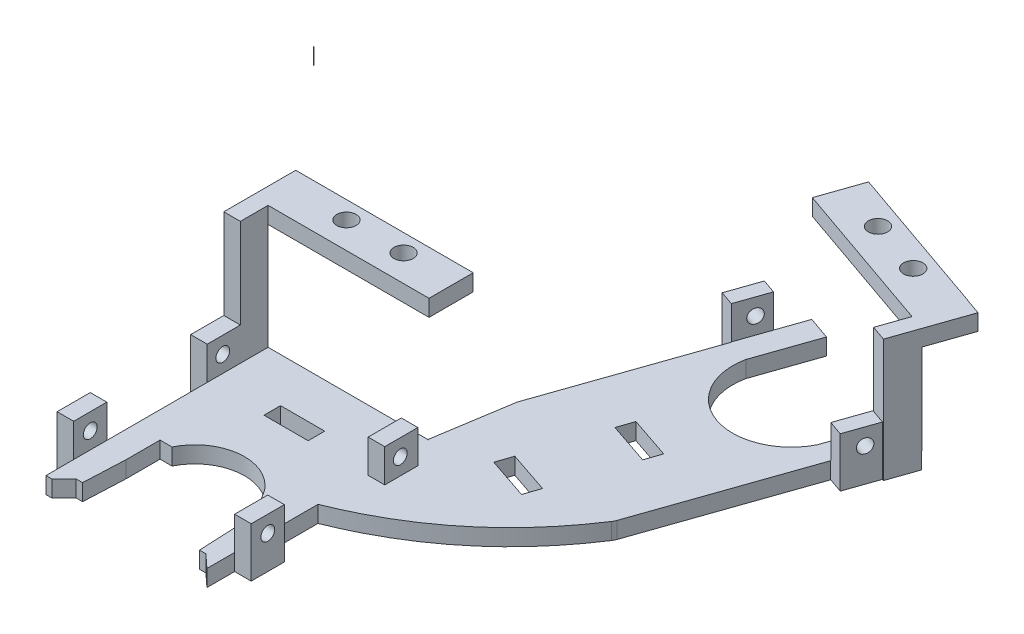
from build123d import *

# Parameters (mm, degrees)
SKETCH1_W                 = 29.13
SKETCH1_H                 = 40.2
BOSS_EXTRUDE1_DEPTH       = 3
SKETCH3_W                 = 6
SKETCH3_H                 = 3
BOSS_EXTRUDE2_DEPTH       = 3
SKETCH4_W                 = 3
SKETCH4_H                 = 6
BOSS_EXTRUDE3_DEPTH       = 6
SKETCH6_W                 = 6
SKETCH6_H                 = 3
BOSS_EXTRUDE4_DEPTH       = 2
SKETCH7_W                 = 3.000000005
SKETCH7_H                 = 6
BOSS_EXTRUDE6_DEPTH       = 6
SKETCH9_R                 = 1.25
CUT_EXTRUDE1_DEPTH        = 3
SKETCH8_R                 = 1.250000001
CUT_EXTRUDE2_DEPTH        = 3
SKETCH11_W                = 6
SKETCH11_H                = 3
BOSS_EXTRUDE7_DEPTH       = 3
SKETCH19_W                = 3
SKETCH19_H                = 6
BOSS_EXTRUDE11_DEPTH      = 6
SKETCH21_W                = 6
SKETCH21_H                = 3
BOSS_EXTRUDE12_DEPTH      = 3
SKETCH22_W                = 3
SKETCH22_H                = 6
BOSS_EXTRUDE13_DEPTH      = 6
SKETCH24_R                = 1.25
CUT_EXTRUDE5_DEPTH        = 4
SKETCH23_R                = 1.25
CUT_EXTRUDE6_DEPTH        = 4
CUT_EXTRUDE8_DEPTH        = 4
CUT_EXTRUDE11_DEPTH       = 4
SKETCH30_W                = 25.92
SKETCH30_H                = 3
CUT_EXTRUDE12_DEPTH       = 15
SKETCH33_W                = 29.17650364
SKETCH33_H                = 3
BOSS_EXTRUDE14_DEPTH      = 40.3
SKETCH34_W                = 21.00258235
SKETCH34_H                = 3
CUT_EXTRUDE15_DEPTH       = 25
CUT_EXTRUDE16_DEPTH       = 5
SKETCH37_W                = 4.5
SKETCH37_H                = 3
SKETCH37_W_2              = 1.5
BOSS_EXTRUDE15_DEPTH      = 3
BOSS_EXTRUDE16_DEPTH      = 6
SKETCH41_W                = 6
SKETCH41_H                = 3
BOSS_EXTRUDE17_DEPTH      = 2.8
BOSS_EXTRUDE18_DEPTH      = 6
SKETCH44_R                = 1.25
CUT_EXTRUDE19_DEPTH       = 7
SKETCH45_R                = 1.249999996
CUT_EXTRUDE20_DEPTH       = 5
SKETCH46_W                = 5.02
SKETCH46_H                = 3
BOSS_EXTRUDE19_DEPTH      = 3
SKETCH48_W                = 3
SKETCH48_H                = 5.02
BOSS_EXTRUDE20_DEPTH      = 22.25
BOSS_EXTRUDE22_DEPTH      = 29.13
BOSS_EXTRUDE22_DEPTH_BACK = 3
SKETCH50_W                = 8
SKETCH50_H                = 3
SKETCH51_R                = 1.75
CUT_EXTRUDE21_DEPTH       = 5
SKETCH56_W                = 3.994197227
SKETCH56_H                = 3.994197227
CUT_EXTRUDE26_DEPTH       = 0.1
FILLET4_START             = -19
FILLET4_DEPTH             = 5
BOSS_EXTRUDE28_DEPTH      = 0.21
BOSS_EXTRUDE29_DEPTH      = 3
BOSS_EXTRUDE30_DEPTH      = 1.95
BOSS_EXTRUDE30_DEPTH_BACK = 4
SKETCH68_W                = 4.32399603
SKETCH68_H                = 3
SKETCH69_W                = 3.919724064
SKETCH69_H                = 3
BOSS_EXTRUDE31_DEPTH      = 1.83
SKETCH70_W                = 5.44243662
SKETCH70_H                = 3
BOSS_EXTRUDE32_DEPTH      = 3.1
BOSS_EXTRUDE33_DEPTH      = 19.18
SKETCH72_W                = 3.07
SKETCH72_H                = 2.93342148
BOSS_EXTRUDE34_DEPTH      = 8
SKETCH73_W                = 8
SKETCH73_H                = 2.93342148
BOSS_EXTRUDE35_DEPTH      = 29.13
SKETCH74_R                = 1.75
CUT_EXTRUDE27_DEPTH       = 5
BOSS_EXTRUDE36_DEPTH      = 3
BOSS_EXTRUDE37_DEPTH      = 3
SKETCH77_W                = 8
SKETCH77_H                = 3
CUT_EXTRUDE28_DEPTH       = 10
CUT_EXTRUDE29_DEPTH       = 10


with BuildPart() as part:
    # Sketch1 → Boss-Extrude1 (new body)
    with BuildSketch(Plane(origin=(0, 0, 0), x_dir=(1, 0, 0), z_dir=(0, 1, 0))):
        with Locations((-32.231128585, -983.966354464)):
            Rectangle(SKETCH1_W, SKETCH1_H)
        with BuildLine():
            Line((-15.507778999, -950.239071497), (-17.666128585, -963.866354464))
            Line((-17.666128585, -963.866354464), (-17.666128585, -983.966354464))
            add(Edge.make_bspline(
                [(11.825950039, -959.709415703), (1.028086592, -976.494542347), (-17.666128585, -983.966354464)],
                knots=[0, 0, 0, 1, 1, 1], degree=2))
            Line((11.825950039, -959.709415703), (-15.497121464, -950.208422428))
            Line((-15.497121464, -950.208422428), (-15.507778999, -950.239071497))
        make_face()
    extrude(amount=-BOSS_EXTRUDE1_DEPTH)

    # Sketch3 → Boss-Extrude2 (add)
    with BuildSketch(Plane.ZY.offset(46.796128585)):
        with Locations((971.886354464, -1.5)):
            Rectangle(SKETCH3_W, SKETCH3_H)
    extrude(amount=BOSS_EXTRUDE2_DEPTH)

    # Sketch4 → Boss-Extrude3 (add)
    with BuildSketch(Plane.XZ.offset(3)):
        with Locations((-48.296128585, 971.886354464)):
            Rectangle(SKETCH4_W, SKETCH4_H)
    extrude(amount=BOSS_EXTRUDE3_DEPTH)

    # Sketch6 → Boss-Extrude4 (add)
    with BuildSketch(Plane(origin=(-17.666128585, 0, 0), x_dir=(0, 0, -1), z_dir=(1, 0, 0))):
        with Locations((-971.886354464, -1.5)):
            Rectangle(SKETCH6_W, SKETCH6_H)
    extrude(amount=BOSS_EXTRUDE4_DEPTH)

    # Sketch7 → Boss-Extrude6 (add)
    with BuildSketch(Plane.XZ.offset(3)):
        with Locations((-16.166128583, 971.886354464)):
            Rectangle(SKETCH7_W, SKETCH7_H)
    extrude(amount=BOSS_EXTRUDE6_DEPTH)

    # Sketch9 → Cut-Extrude1 (cut)
    with BuildSketch(Plane.ZY.offset(17.666128585)):
        with Locations((972.066354464, -6)):
            Circle(SKETCH9_R)
    extrude(amount=-CUT_EXTRUDE1_DEPTH, mode=Mode.SUBTRACT)

    # Sketch8 → Cut-Extrude2 (cut)
    with BuildSketch(Plane(origin=(-49.796128585, 0, 0), x_dir=(0, 0, -1), z_dir=(1, 0, 0))):
        with Locations(Location((-972.066168305, -5.999675203, 0), (0, 0, 180))):
            Circle(SKETCH8_R)
    extrude(amount=CUT_EXTRUDE2_DEPTH, mode=Mode.SUBTRACT)

    # Sketch11 → Boss-Extrude7 (add)
    with BuildSketch(Plane.ZY.offset(46.796128585)):
        with Locations((996.056354464, -1.5)):
            Rectangle(SKETCH11_W, SKETCH11_H)
    extrude(amount=BOSS_EXTRUDE7_DEPTH)

    # Sketch19 → Boss-Extrude11 (add)
    with BuildSketch(Plane.XZ.offset(3)):
        with Locations((-48.296128585, 996.056354464)):
            Rectangle(SKETCH19_W, SKETCH19_H)
    extrude(amount=BOSS_EXTRUDE11_DEPTH)

    # Sketch21 → Boss-Extrude12 (add)
    with BuildSketch(Plane(origin=(-17.666128585, 0, 0), x_dir=(0, 0, -1), z_dir=(1, 0, 0))):
        with Locations((-996.056354464, -1.5)):
            Rectangle(SKETCH21_W, SKETCH21_H)
    extrude(amount=BOSS_EXTRUDE12_DEPTH)

    # Sketch22 → Boss-Extrude13 (add)
    with BuildSketch(Plane.XZ.offset(3)):
        with Locations((-16.166128585, 996.056354464)):
            Rectangle(SKETCH22_W, SKETCH22_H)
    extrude(amount=BOSS_EXTRUDE13_DEPTH)

    # Sketch24 → Cut-Extrude5 (cut)
    with BuildSketch(Plane(origin=(-46.796128585, 0, 0), x_dir=(0, 0, -1), z_dir=(1, 0, 0))):
        with Locations((-996.058375158, -6)):
            Circle(SKETCH24_R)
    extrude(amount=-CUT_EXTRUDE5_DEPTH, mode=Mode.SUBTRACT)

    # Sketch23 → Cut-Extrude6 (cut)
    with BuildSketch(Plane.ZY.offset(17.666128585)):
        with Locations((996.058154464, -6)):
            Circle(SKETCH23_R)
    extrude(amount=-CUT_EXTRUDE6_DEPTH, mode=Mode.SUBTRACT)

    # Sketch28 → Cut-Extrude8 (cut)
    with BuildSketch(Plane(origin=(0, 0, 0), x_dir=(1, 0, 0), z_dir=(0, 1, 0))):
        Polygon((-39.266128585, -975.05646378), (-24.308019321, -978.056409122), (-24.326128585, -981.056354464), (-39.266128585, -978.146354464), align=None)
    extrude(amount=-CUT_EXTRUDE8_DEPTH, mode=Mode.SUBTRACT)

    # Sketch29 → Cut-Extrude11 (cut)
    with BuildSketch(Plane(origin=(0, 0, 0), x_dir=(1, 0, 0), z_dir=(0, 1, 0))):
        Polygon((-39.266128585, -975.05646378), (-39.865804676, -988.183184315), (-42.032837695, -988.183184315), (-42.032837695, -994.347976596), (-42.376382193, -1001.868057312), (-43.532474114, -1001.868057312), (-45.730771266, -1004.066354464), (-39.266128585, -1004.066354464), (-39.266128585, -988.183184315), align=None)
        Polygon((-24.308019321, -978.056409122), (-24.326128585, -1004.066354464), (-17.666128585, -1004.066354464), (-20.056128585, -1001.868057312), (-21.216128585, -1001.868057312), (-21.426128585, -997.305136389), (-21.556128585, -994.347976596), (-21.556128585, -988.183184315), (-23.726128585, -988.183184315), align=None)
    extrude(amount=-CUT_EXTRUDE11_DEPTH, mode=Mode.SUBTRACT)


with BuildPart() as cut_extrude11_piece_1:
    # of the separate pieces the step leaves, piece 1, a body of its own (cut_extrude11_pieces)
    add(part.part.solids().sort_by_distance((-17.666128585, 0, 983.966354464))[0])


with BuildPart() as cut_extrude11_piece_2:
    # of the separate pieces the step leaves, piece 2, a body of its own (cut_extrude11_pieces)
    add(part.part.solids().sort_by_distance((-24.326128585, 0, 1004.066354464))[0])


with BuildPart() as cut_extrude12_tool:
    # Sketch30 → Cut-Extrude12 (new body)
    with BuildSketch(Plane.ZY.offset(39.266128585)):
        with Locations((991.106354464, -1.5)):
            Rectangle(SKETCH30_W, SKETCH30_H)
    extrude(amount=-CUT_EXTRUDE12_DEPTH)


with BuildPart() as cut_extrude11_piece_1_1:
    add(cut_extrude11_piece_1.part)

    # Cut-Extrude12: cut by cut_extrude12_tool
    add(cut_extrude12_tool.part, mode=Mode.SUBTRACT)

    # Sketch33 → Boss-Extrude14 (add)
    with BuildSketch(Plane(origin=(-296.443416752, 0, 852.515567448), x_dir=(-0.9445255798324886, 0, -0.32843786176703366), z_dir=(0.3284378617670337, 0, -0.9445255798324887))):
        with Locations((-311.77524668, -1.5)):
            Rectangle(SKETCH33_W, SKETCH33_H)
    extrude(amount=BOSS_EXTRUDE14_DEPTH)

    # Sketch34 → Cut-Extrude15 (cut)
    with BuildSketch(Plane(origin=(-283.207370923, 0, 814.451186581), x_dir=(-0.9445255798324887, 0, -0.32843786176703327), z_dir=(0.32843786176703327, 0, -0.9445255798324887))):
        with Locations((-311.942483261, -1.5)):
            Rectangle(SKETCH34_W, SKETCH34_H)
    extrude(amount=-CUT_EXTRUDE15_DEPTH, mode=Mode.SUBTRACT)

    # Sketch35 → Cut-Extrude16 (cut)
    with BuildSketch(Plane(origin=(0, 0, 0), x_dir=(1, 0, 0), z_dir=(0, 1, 0))):
        Polygon((-6.699400727, -937.069026653), (11.67040627, -948.187810964), (13.138075545, -943.967069892), align=None)
    extrude(amount=-CUT_EXTRUDE16_DEPTH, mode=Mode.SUBTRACT)

    # Sketch37 → Boss-Extrude15 (add)
    with BuildSketch(Plane(origin=(280.946295288, 0, 97.69285498), x_dir=(-0.32843786176743117, 0, 0.9445255798323505), z_dir=(-0.9445255798323505, 0, -0.32843786176743117))):
        with Locations((868.136002588, -1.5)):
            Rectangle(SKETCH37_W, SKETCH37_H)
        with Locations((871.136002588, -1.5)):
            Rectangle(SKETCH37_W_2, SKETCH37_H)
    extrude(amount=BOSS_EXTRUDE15_DEPTH)

    # Sketch39 → Boss-Extrude16 (add)
    with BuildSketch(Plane.XZ.offset(3)):
        Polygon((-6.277028676, 914.559020058), (-3.745700122, 915.439233528), (-5.716327292, 921.106387007), (-8.247655846, 920.226173537), align=None)
    extrude(amount=BOSS_EXTRUDE16_DEPTH)

    # Sketch41 → Boss-Extrude17 (add)
    with BuildSketch(Plane(origin=(308.258672657, 0, 107.190129606), x_dir=(0.3284378617670337, 0, -0.9445255798324887), z_dir=(0.9445255798324887, 0, 0.3284378617670337))):
        with Locations((-868.898439213, -1.5)):
            Rectangle(SKETCH41_W, SKETCH41_H)
    extrude(amount=BOSS_EXTRUDE17_DEPTH)

    # Sketch42 → Boss-Extrude18 (add)
    with BuildSketch(Plane.XZ.offset(3)):
        Polygon((23.893176542, 925.063208116), (21.922549371, 930.730361595), (24.538885227, 931.640134472), (26.509512398, 925.972980993), align=None)
    extrude(amount=BOSS_EXTRUDE18_DEPTH)

    # Sketch44 → Cut-Extrude19 (cut)
    with BuildSketch(Plane(origin=(278.112718549, 0, 96.707541395), x_dir=(0.32843786176743106, 0, -0.9445255798323505), z_dir=(0.9445255798323505, 0, 0.32843786176743106))):
        with Locations(Location((-868.443002584, -6.00009913, 0), (0, 0, 180))):
            Circle(SKETCH44_R)
    extrude(amount=CUT_EXTRUDE19_DEPTH, mode=Mode.SUBTRACT)

    # Sketch45 → Cut-Extrude20 (cut)
    with BuildSketch(Plane(origin=(310.90334428, 0, 108.109755619), x_dir=(0.32843786176704176, 0, -0.9445255798324859), z_dir=(0.944525579832486, 0, 0.32843786176704176))):
        with Locations((-868.363002583, -6.00009913)):
            Circle(SKETCH45_R)
    extrude(amount=-CUT_EXTRUDE20_DEPTH, mode=Mode.SUBTRACT)


with BuildPart() as cut_extrude11_piece_2_1:
    add(cut_extrude11_piece_2.part)

    # Cut-Extrude12: cut by cut_extrude12_tool
    add(cut_extrude12_tool.part, mode=Mode.SUBTRACT)


with BuildPart() as body_3:
    # Mirror1: mirrored copy
    add(cut_extrude11_piece_1_1.part.mirror(Plane(origin=(0, -9, 0), x_dir=(0, 0, 1), z_dir=(0, -1, 0))))

    # Sketch46 → Boss-Extrude19 (add)
    with BuildSketch(Plane.ZY.offset(46.796128585)):
        with Locations((966.376354464, -16.5)):
            Rectangle(SKETCH46_W, SKETCH46_H)
    extrude(amount=BOSS_EXTRUDE19_DEPTH)

    # Sketch48 → Boss-Extrude20 (add)
    with BuildSketch(Plane(origin=(0, -15, 0), x_dir=(1, 0, 0), z_dir=(0, 1, 0))):
        with Locations((-48.296128585, -966.376354464)):
            Rectangle(SKETCH48_W, SKETCH48_H)
    extrude(amount=BOSS_EXTRUDE20_DEPTH)

    # Sketch50 → Boss-Extrude22 (add, two sides: drawn at the far end of the back side and taken through both)
    with BuildSketch(Plane(origin=(-46.796128585, 0, 0), x_dir=(0, 0, -1), z_dir=(1, 0, 0)).offset(-BOSS_EXTRUDE22_DEPTH_BACK)):
        with Locations((-959.866354464, 5.75)):
            Rectangle(SKETCH50_W, SKETCH50_H)
    extrude(amount=BOSS_EXTRUDE22_DEPTH + BOSS_EXTRUDE22_DEPTH_BACK)

    # Sketch51 → Cut-Extrude21 (cut)
    with BuildSketch(Plane(origin=(0, 7.25, 0), x_dir=(1, 0, 0), z_dir=(0, 1, 0))):
        with Locations(Location((-37.42112854, -959.066354487, 0), (0, 0, 270))):
            Circle(SKETCH51_R)
        with Locations(Location((-27.07112854, -959.066354497, 0), (0, 0, 270))):
            Circle(SKETCH51_R)
    extrude(amount=-CUT_EXTRUDE21_DEPTH, mode=Mode.SUBTRACT)

    # Sketch56 → Cut-Extrude26 (cut)
    with BuildSketch(Plane(origin=(-283.207370923, 0, 814.451186581), x_dir=(-0.9445255798324892, 0, -0.32843786176703227), z_dir=(0.32843786176703227, 0, -0.9445255798324892))):
        with Locations((-299.444093473, -16.997098614)):
            Rectangle(SKETCH56_W, SKETCH56_H)
    extrude(amount=-CUT_EXTRUDE26_DEPTH, mode=Mode.SUBTRACT)

    # Fillet4: read off the stored shape, not the designer's step
    # Fillet4 outline → Fillet4 (cut)
    with BuildSketch(Plane(origin=(0, 0, 0), x_dir=(1, 0, 0), z_dir=(0, 1, 0)).offset(FILLET4_START)):
        with BuildLine():
            Line((11.815255904, -959.705697054), (11.918892326, -959.407658179))
            ThreePointArc((11.918892326, -959.407658179), (11.77847749, -959.744040081), (11.598302874, -960.060909482))
            add(Edge.make_bspline(
                [(11.825950039, -959.709415703), (11.712561825, -959.885676085), (11.598302874, -960.060909482)],
                knots=[0, 0, 0, 0.010500986, 0.010500986, 0.010500986], degree=2))
            Line((11.825950039, -959.709415703), (11.815255904, -959.705697054))
        make_face()
    extrude(amount=FILLET4_DEPTH, mode=Mode.SUBTRACT)


with BuildPart() as body_3_2:
    # Mirror2: mirrored copy
    add(body_3.part.mirror(Plane(origin=(-13.559951136, -18, 962.196424994), x_dir=(0, 0, 1), z_dir=(0, -1, 0))))

    # Sketch63 → Boss-Extrude28 (add)
    with BuildSketch(Plane(origin=(131.691734271, 0, 20.857921628), x_dir=(-0.15643446504022615, 0, 0.9876883405951385), z_dir=(-0.9876883405951385, 0, -0.15643446504022615))):
        with BuildLine():
            add(Edge.make_bspline(
                [(954.763151571, -21), (947.864577189, -21), (940.966002807, -21)],
                knots=[0, 0, 0, 1, 1, 1], degree=2))
            Line((940.966002807, -21), (940.966002807, -18))
            add(Edge.make_bspline(
                [(954.763151571, -18), (947.864577189, -18), (940.966002807, -18)],
                knots=[0, 0, 0, 1, 1, 1], degree=2))
            Line((954.763151571, -18), (954.763151571, -21))
        make_face()
    extrude(amount=BOSS_EXTRUDE28_DEPTH)

    # Sketch67 → Boss-Extrude29 (add)
    with BuildSketch(Plane(origin=(0, -18, 0), x_dir=(1, 0, 0), z_dir=(0, 1, 0))):
        Polygon((-15.715193551, -950.206220259), (-15.742698114, -950.123028585), (-15.497121464, -950.208422428), (-15.507778999, -950.239071497), align=None)
    extrude(amount=-BOSS_EXTRUDE29_DEPTH)

    # Sketch68 → Boss-Extrude30 (add, two sides: drawn at the far end of the back side and taken through both)
    with BuildSketch(Plane(origin=(-283.240214709, 0, 814.545639139), x_dir=(-0.9445255798324883, -3.1744861168227707e-15, -0.32843786176703493), z_dir=(0.32843786176703493, -9.129225613729643e-15, -0.9445255798324883)).offset(-BOSS_EXTRUDE30_DEPTH_BACK)):
        with Locations((-299.279194071, -19.5)):
            Rectangle(SKETCH68_W, SKETCH68_H)
    extrude(amount=BOSS_EXTRUDE30_DEPTH + BOSS_EXTRUDE30_DEPTH_BACK)

    # Sketch69 → Boss-Extrude31 (add)
    with BuildSketch(Plane(origin=(-283.207370923, 0, 814.451186581), x_dir=(-0.9445255798324895, 0, -0.32843786176703144), z_dir=(0.32843786176703144, 0, -0.9445255798324895))):
        with Locations((-324.403636468, -19.5)):
            Rectangle(SKETCH69_W, SKETCH69_H)
    extrude(amount=BOSS_EXTRUDE31_DEPTH)

    # Sketch70 → Boss-Extrude32 (add)
    with BuildSketch(Plane(origin=(308.258672657, 0, 107.190129606), x_dir=(0.3284378617670337, 0, -0.9445255798324887), z_dir=(0.9445255798324887, 0, 0.3284378617670337))):
        with Locations((-863.177220903, -19.5)):
            Rectangle(SKETCH70_W, SKETCH70_H)
    extrude(amount=BOSS_EXTRUDE32_DEPTH)

    # Sketch71 → Boss-Extrude33 (add)
    with BuildSketch(Plane.XZ.offset(21)):
        Polygon((28.589002033, 920.906174309), (26.792870072, 926.071512351), (24.05374589, 925.119042552), (25.841248137, 919.978521948), align=None)
    extrude(amount=BOSS_EXTRUDE33_DEPTH)

    # Sketch72 → Boss-Extrude34 (add)
    with BuildSketch(Plane(origin=(-282.606329636, 0, 812.722704769), x_dir=(-0.9445255798324861, 0, -0.3284378617670412), z_dir=(0.3284378617670412, 0, -0.9445255798324861))):
        with Locations((-327.9284985, -38.71328926)):
            Rectangle(SKETCH72_W, SKETCH72_H)
    extrude(amount=BOSS_EXTRUDE34_DEPTH)

    # Sketch73 → Boss-Extrude35 (add)
    with BuildSketch(Plane(origin=(308.287008424, 0, 107.199982742), x_dir=(-0.3284378617669627, 0, 0.9445255798325134), z_dir=(-0.9445255798325134, 0, -0.3284378617669627))):
        with Locations((856.429727564, -38.71328926)):
            Rectangle(SKETCH73_W, SKETCH73_H)
    extrude(amount=BOSS_EXTRUDE35_DEPTH)

    # Sketch74 → Cut-Extrude27 (cut)
    with BuildSketch(Plane.XZ.offset(40.18)):
        with Locations(Location((18.400180873, 912.294602496, 0), (0, 0, 270))):
            Circle(SKETCH74_R)
        with Locations(Location((8.624341118, 908.895270636, 0), (0, 0, 270))):
            Circle(SKETCH74_R)
    extrude(amount=-CUT_EXTRUDE27_DEPTH, mode=Mode.SUBTRACT)


with BuildPart() as body_3_3:
    # Mirror3: mirrored copy
    add(body_3_2.part.mirror(Plane(origin=(-34.71161526, -43.25, 960.314964031), x_dir=(0, 0, 1), z_dir=(0, -1, 0))))


with BuildPart() as body_3_4:
    # Mirror4: read off the stored shape, not the designer's step
    # Mirror4: mirrored copy
    add(body_3_3.part.mirror(Plane(origin=(0, -43.25, 0), x_dir=(1, 0, 0), z_dir=(0, 1, 0))))


with BuildPart() as body_3_5:
    # Mirror5: mirrored copy
    add(body_3_4.part.mirror(Plane(origin=(-34.71161526, -43.25, 960.314964031), x_dir=(0, 0, 1), z_dir=(0, -1, 0))))

    # Sketch75 → Boss-Extrude36 (add)
    with BuildSketch(Plane(origin=(0, -68.5, 0), x_dir=(-1, 0, 0), z_dir=(0, -1, 0))):
        with BuildLine():
            Line((24.266128585, -978.146354464), (23.726128585, -988.183184315))
            ThreePointArc((23.726128585, -988.183184315), (31.795966631, -983.138510724), (39.865804676, -988.183184315))
            Line((39.865804676, -988.183184315), (39.266128585, -975.05646378))
            Line((39.266128585, -975.05646378), (24.308019321, -978.056409122))
            Line((24.308019321, -978.056409122), (24.302851007, -978.146354464))
            Line((24.302851007, -978.146354464), (24.266128585, -978.146354464))
        make_face()
    extrude(amount=-BOSS_EXTRUDE36_DEPTH)

    # Sketch76 → Boss-Extrude37 (add)
    with BuildSketch(Plane.XZ.offset(68.5)):
        with BuildLine():
            ThreePointArc((-1.645542313, 922.53507943), (5.240935017, 934.704313393), (18.191933959, 929.433122668))
            Line((18.191933959, 929.433122668), (11.67040627, 948.187810964))
            Line((11.67040627, 948.187810964), (-6.699400727, 937.069026653))
            Line((-6.699400727, 937.069026653), (-1.645542313, 922.53507943))
        make_face()
    extrude(amount=-BOSS_EXTRUDE37_DEPTH)

    # Sketch77 → Cut-Extrude28 (cut)
    with BuildSketch(Plane.XZ.offset(68.5)):
        with Locations((-32.524073244, 973.386354464)):
            Rectangle(SKETCH77_W, SKETCH77_H)
    extrude(amount=-CUT_EXTRUDE28_DEPTH, mode=Mode.SUBTRACT)

    # Sketch81 → Cut-Extrude29 (cut)
    with BuildSketch(Plane.XZ.offset(68.5)):
        Polygon((4.750153018, 947.612826843), (0.960073588, 946.334039168), (-2.830005841, 945.055251493), (-1.870915085, 942.21269192), (5.709243774, 944.770267271), align=None)
        Polygon((-0.780945581, 964.005933713), (-4.571025011, 962.727146038), (-8.36110444, 961.448358362), (-7.402013684, 958.60579879), (0.178145175, 961.163374141), align=None)
    extrude(amount=-CUT_EXTRUDE29_DEPTH, mode=Mode.SUBTRACT)


solid = Compound([cut_extrude11_piece_2_1.part, body_3_5.part])
